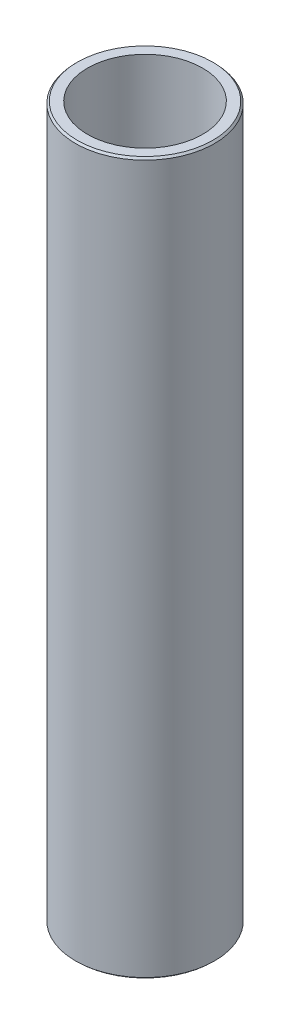
from build123d import *
from OCP.BRepFilletAPI import BRepFilletAPI_MakeChamfer

# Parameters (mm, degrees)
SKETCH1_R           = 55
BOSS_EXTRUDE1_DEPTH = 563.064663054
SKETCH2_R           = 45.524548651
CUT_EXTRUDE1_DEPTH  = 569.41165961
CHAMFER1_SIZE       = 1.530264542
CHAMFER1_SIZE2      = 1.385517527


with BuildPart() as part:
    # Sketch1 → Boss-Extrude1 (new body)
    with BuildSketch(Plane(origin=(0, 0, 0), x_dir=(1, 0, 0), z_dir=(0, 1, 0))):
        Circle(SKETCH1_R)
    extrude(amount=BOSS_EXTRUDE1_DEPTH)

    # Sketch2 → Cut-Extrude1 (cut, through all)
    with BuildSketch(Plane(origin=(0, 0, 0), x_dir=(1, 0, 0), z_dir=(0, 1, 0))):
        Circle(SKETCH2_R)
    extrude(amount=CUT_EXTRUDE1_DEPTH, mode=Mode.SUBTRACT)

    # Chamfer1: one chamfer whose edges measure the first distance from different faces: ONE call of the kernel's chamfer builder (chamfer() names one face for all edges)
    chamfer1_edges_1 = [part.edges().sort_by_distance(p)[0] for p in [
        (-55, 563.064663054, 0),
    ]]
    chamfer1_side_1 = [part.faces().sort_by_distance(p)[0] for p in [
        (-55, 281.532331527, 0),
    ]]
    chamfer1_edges_2 = [part.edges().sort_by_distance(p)[0] for p in [
        (-55, 0, 0),
    ]]
    chamfer1_side_2 = [part.faces().sort_by_distance(p)[0] for p in [
        (-53.444365081, 0, 0),
    ]]
    chamfer1 = BRepFilletAPI_MakeChamfer(part.part.solid().wrapped)
    for e in chamfer1_edges_1:
        chamfer1.Add(CHAMFER1_SIZE, CHAMFER1_SIZE2, e.wrapped, chamfer1_side_1[0].wrapped)  # the first distance lies on this face
    for e in chamfer1_edges_2:
        chamfer1.Add(CHAMFER1_SIZE, CHAMFER1_SIZE2, e.wrapped, chamfer1_side_2[0].wrapped)  # the first distance lies on this face
    add(Compound.cast(chamfer1.Shape()), mode=Mode.REPLACE)


solid = part.part
